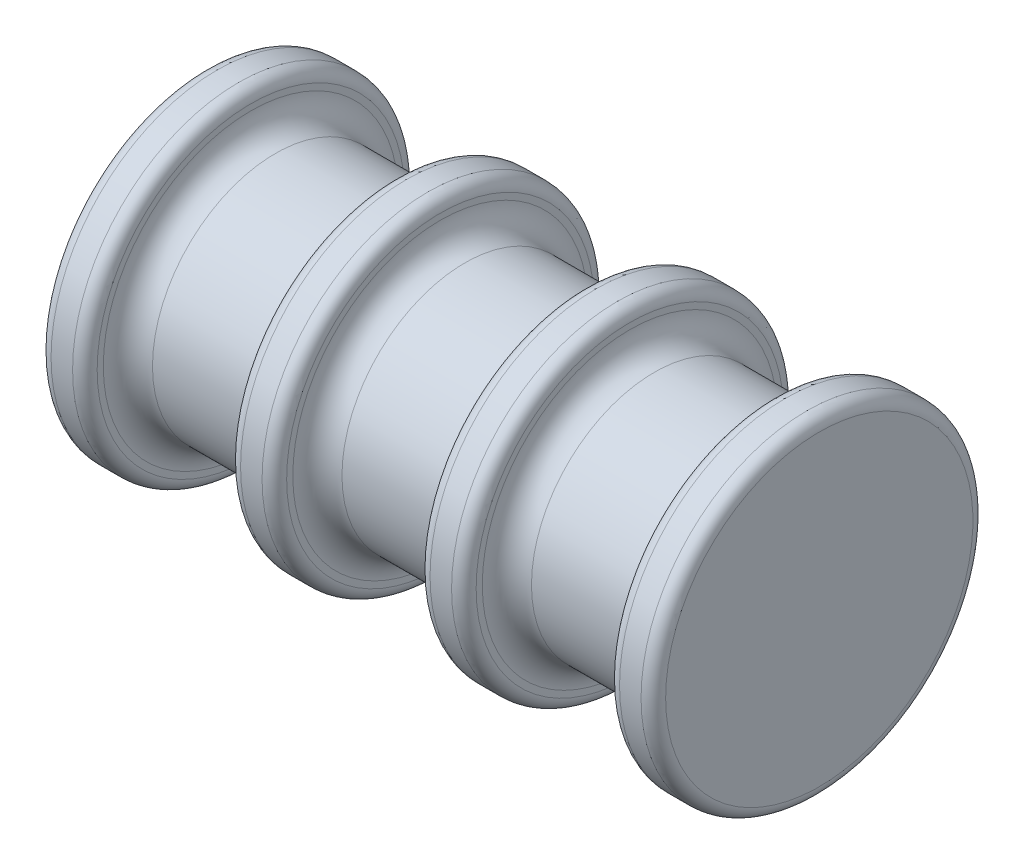
from build123d import *

# Parameters (mm, degrees)
SKETCH3_R          = 5.08
SKETCH3_R_2        = 3.81
CUT_EXTRUDE1_DEPTH = 0.254
SKETCH4_R          = 1.788985249
SKETCH4_R_2        = 1.265871179
CUT_EXTRUDE2_DEPTH = 0.2032
FILLET1_R          = 0.0254
FILLET3_R          = 0.1016
FILLET5_R          = 0.127


with BuildPart() as part:
    # Sketch1 → Revolve1 (revolve)
    with BuildSketch(Plane(origin=(0, 0, 0), x_dir=(1, 0, 0), z_dir=(0, 1, 0)), mode=Mode.PRIVATE) as revolve1_sk:
        with BuildLine():
            Line((0.762, 10.287), (2.0955, 10.287))
            ThreePointArc((2.0955, 10.287), (2.634315367, 10.063815367), (2.8575, 9.525))
            Line((2.8575, 9.525), (2.8575, 9.144))
            ThreePointArc((2.8575, 9.144), (3.303869265, 8.066369265), (4.3815, 7.62))
            Line((4.3815, 7.62), (10.2235, 7.62))
            ThreePointArc((10.2235, 7.62), (11.301130735, 8.066369265), (11.7475, 9.144))
            Line((11.7475, 9.144), (11.7475, 9.525))
            ThreePointArc((11.7475, 9.525), (11.970684633, 10.063815367), (12.5095, 10.287))
            Line((12.5095, 10.287), (13.843, 10.287))
            ThreePointArc((13.843, 10.287), (14.381815367, 10.063815367), (14.605, 9.525))
            Line((14.605, 9.525), (14.605, 9.144))
            ThreePointArc((14.605, 9.144), (15.051369265, 8.066369265), (16.129, 7.62))
            Line((16.129, 7.62), (21.971, 7.62))
            ThreePointArc((21.971, 7.62), (23.048630735, 8.066369265), (23.495, 9.144))
            Line((23.495, 9.144), (23.495, 9.525))
            ThreePointArc((23.495, 9.525), (23.718184633, 10.063815367), (24.257, 10.287))
            Line((24.257, 10.287), (25.5905, 10.287))
            ThreePointArc((25.5905, 10.287), (26.129315367, 10.063815367), (26.3525, 9.525))
            Line((26.3525, 9.525), (26.3525, 9.144))
            ThreePointArc((26.3525, 9.144), (26.798869265, 8.066369265), (27.8765, 7.62))
            Line((27.8765, 7.62), (33.7185, 7.62))
            ThreePointArc((33.7185, 7.62), (34.796130735, 8.066369265), (35.2425, 9.144))
            Line((35.2425, 9.144), (35.2425, 9.525))
            ThreePointArc((35.2425, 9.525), (35.465684633, 10.063815367), (36.0045, 10.287))
            Line((36.0045, 10.287), (37.338, 10.287))
            ThreePointArc((37.338, 10.287), (37.876815367, 10.063815367), (38.1, 9.525))
            Line((38.1, 9.525), (38.1, 0))
            Line((38.1, 0), (0, 0))
            Line((0, 0), (0, 9.525))
            ThreePointArc((0, 9.525), (0.223184633, 10.063815367), (0.762, 10.287))
        make_face()
    revolve(revolve1_sk.sketch.rotate(Axis((0, 0, 0), (1, 0, 0)), 180), axis=Axis((0, 0, 0), (1, 0, 0)))

    # Sketch3 → Cut-Extrude1 (cut)
    with BuildSketch(Plane.ZY):
        Circle(SKETCH3_R)
        Circle(SKETCH3_R_2, mode=Mode.SUBTRACT)
    extrude(amount=-CUT_EXTRUDE1_DEPTH, mode=Mode.SUBTRACT)

    # Sketch4 → Cut-Extrude2 (cut)
    with BuildSketch(Plane.ZY):
        Circle(SKETCH4_R)
        Circle(SKETCH4_R_2, mode=Mode.SUBTRACT)
    extrude(amount=-CUT_EXTRUDE2_DEPTH, mode=Mode.SUBTRACT)

    # Fillet1
    fillet1_edges = [part.edges().sort_by_distance(p)[0] for p in [
        (0.254, 0, -5.08),
        (0, 0, -5.08),
    ]]
    fillet(fillet1_edges, radius=FILLET1_R)

    # Fillet3
    fillet3_edges = [part.edges().sort_by_distance(p)[0] for p in [
        (0.2032, 0, -1.788985249),
        (0, 0, -1.788985249),
        (0, 0, -1.265871179),
    ]]
    fillet(fillet3_edges, radius=FILLET3_R - 0.0001)  # a hair under: the kernel refuses the full size

    # Fillet5
    fillet5_edges = [part.edges().sort_by_distance(p)[0] for p in [
        (0.254, 0, -3.81),
        (0, 0, -3.81),
    ]]
    fillet(fillet5_edges, radius=FILLET5_R - 0.0001)  # a hair under: the kernel refuses the full size


solid = part.part
